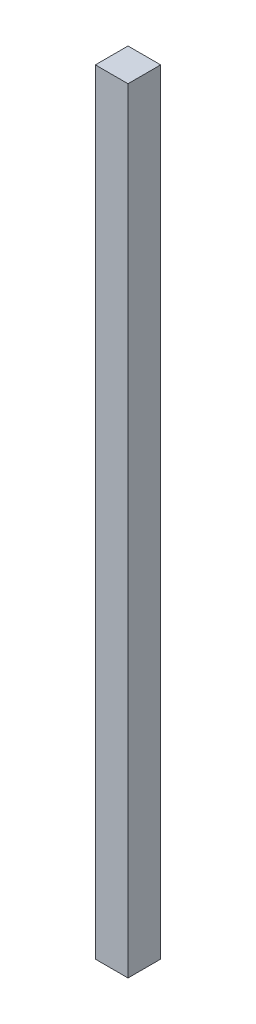
from build123d import *

# Parameters (mm, degrees)
SKETCH1_W           = 88.9
SKETCH1_H           = 88.9
BOSS_EXTRUDE2_DEPTH = 2108.2


with BuildPart() as part:
    # Sketch1 → Boss-Extrude2 (new body)
    with BuildSketch(Plane(origin=(0, 0, 0), x_dir=(1, 0, 0), z_dir=(0, 1, 0))):
        Rectangle(SKETCH1_W, SKETCH1_H)
    extrude(amount=BOSS_EXTRUDE2_DEPTH)


solid = part.part
